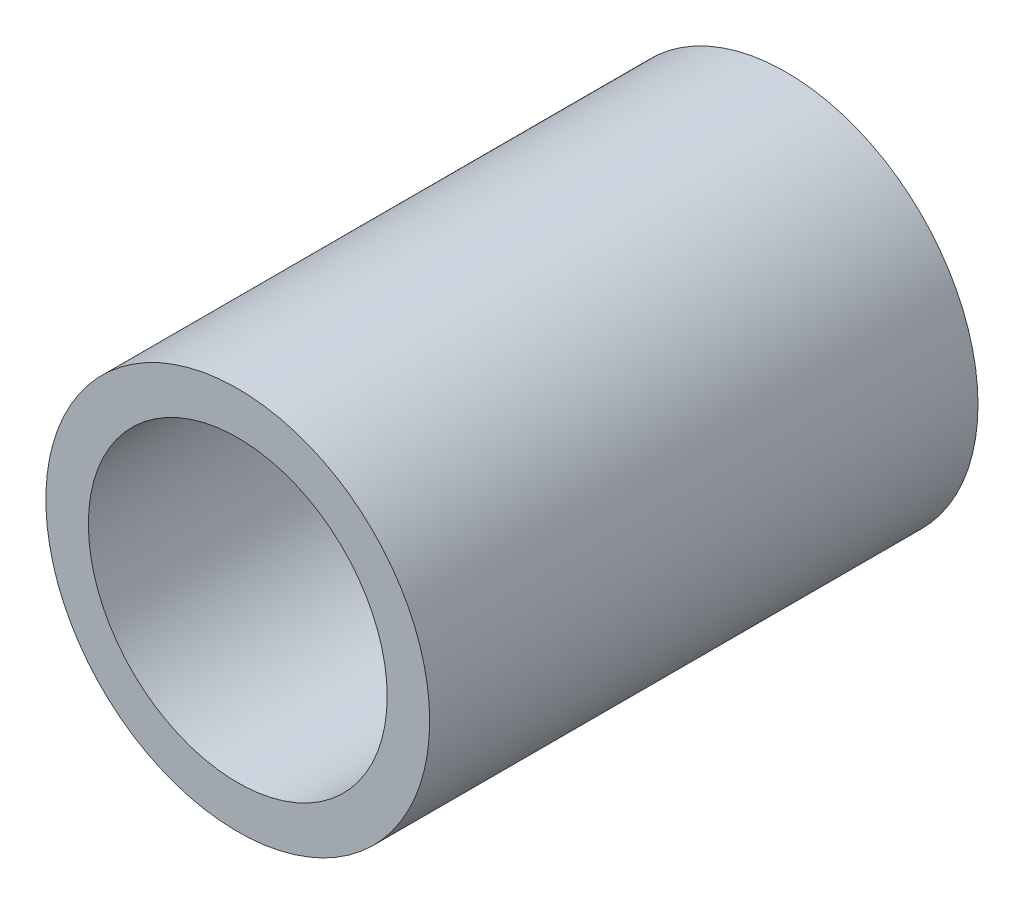
from build123d import *

# Parameters (mm, degrees)
SKETCH1_R           = 3.5
SKETCH1_R_2         = 2.725
BOSS_EXTRUDE1_DEPTH = 10


with BuildPart() as part:
    # Sketch1 → Boss-Extrude1 (new body)
    with BuildSketch(Plane.XY):
        Circle(SKETCH1_R)
        Circle(SKETCH1_R_2, mode=Mode.SUBTRACT)
    extrude(amount=BOSS_EXTRUDE1_DEPTH)


solid = part.part
